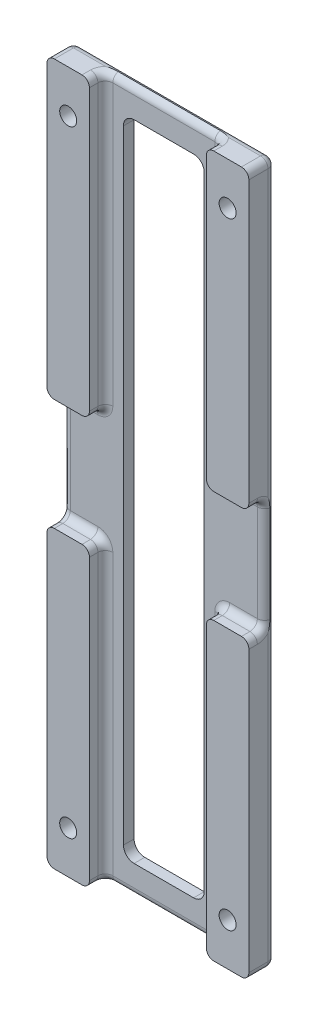
from build123d import *

# Parameters (mm, degrees)
SKETCH1_W           = 55.5
SKETCH1_H           = 8
SKETCH1_R           = 1.6
BOSS_EXTRUDE1_DEPTH = 2
BOSS_EXTRUDE2_START = 2
SKETCH1_3_W         = 55.5
SKETCH1_3_H         = 8
SKETCH1_3_R         = 1.6
BOSS_EXTRUDE2_DEPTH = 3
FILLET1_R           = 1.4
CUT_EXTRUDE1_DEPTH  = 138.393595317


with BuildPart() as part:
    # Sketch1 → Boss-Extrude1 (new body)
    # profile 1 of 5: a face of its own
    with BuildSketch(Plane(origin=(0, 0, 0), x_dir=(0, 1, 0), z_dir=(0, 0, 1))):
        Polygon((76.5, 38), (55.5, 38), (55.5, 30), (0, 30), (0, 8), (55.5, 8), (55.5, 0), (76.5, 0), (76.5, 8), (132, 8), (132, 30), (76.5, 30), align=None)
    # profile 2 of 5: a face of its own
    with BuildSketch(Plane(origin=(0, 0, 0), x_dir=(0, 1, 0), z_dir=(0, 0, 1))):
        with Locations((27.75, 34)):
            Rectangle(SKETCH1_W, SKETCH1_H)
        with Locations(Location((8, 34, 0), (0, 0, 270))):
            Circle(SKETCH1_R, mode=Mode.SUBTRACT)
    # profile 3 of 5: a face of its own
    with BuildSketch(Plane(origin=(0, 0, 0), x_dir=(0, 1, 0), z_dir=(0, 0, 1))):
        with Locations((104.25, 34)):
            Rectangle(SKETCH1_W, SKETCH1_H)
        with Locations(Location((124, 34, 0), (0, 0, 270))):
            Circle(SKETCH1_R, mode=Mode.SUBTRACT)
    # profile 4 of 5: a face of its own
    with BuildSketch(Plane(origin=(0, 0, 0), x_dir=(0, 1, 0), z_dir=(0, 0, 1))):
        with Locations((104.25, 4)):
            Rectangle(SKETCH1_W, SKETCH1_H)
        with Locations(Location((124, 4, 0), (0, 0, 270))):
            Circle(SKETCH1_R, mode=Mode.SUBTRACT)
    # profile 5 of 5: a face of its own
    with BuildSketch(Plane(origin=(0, 0, 0), x_dir=(0, 1, 0), z_dir=(0, 0, 1))):
        with Locations((27.75, 4)):
            Rectangle(SKETCH1_W, SKETCH1_H)
        with Locations(Location((8, 4, 0), (0, 0, 270))):
            Circle(SKETCH1_R, mode=Mode.SUBTRACT)
    extrude(amount=BOSS_EXTRUDE1_DEPTH)

    # Sketch1<3> → Boss-Extrude2 (add)
    # profile 1 of 4: a face of its own
    with BuildSketch(Plane(origin=(0, 0, 0), x_dir=(0, 1, 0), z_dir=(0, 0, 1)).offset(BOSS_EXTRUDE2_START)):
        with Locations((27.75, 34)):
            Rectangle(SKETCH1_3_W, SKETCH1_3_H)
        with Locations(Location((8, 34, 0), (0, 0, 270))):
            Circle(SKETCH1_3_R, mode=Mode.SUBTRACT)
    # profile 2 of 4: a face of its own
    with BuildSketch(Plane(origin=(0, 0, 0), x_dir=(0, 1, 0), z_dir=(0, 0, 1)).offset(BOSS_EXTRUDE2_START)):
        with Locations((104.25, 34)):
            Rectangle(SKETCH1_3_W, SKETCH1_3_H)
        with Locations(Location((124, 34, 0), (0, 0, 270))):
            Circle(SKETCH1_3_R, mode=Mode.SUBTRACT)
    # profile 3 of 4: a face of its own
    with BuildSketch(Plane(origin=(0, 0, 0), x_dir=(0, 1, 0), z_dir=(0, 0, 1)).offset(BOSS_EXTRUDE2_START)):
        with Locations((104.25, 4)):
            Rectangle(SKETCH1_3_W, SKETCH1_3_H)
        with Locations(Location((124, 4, 0), (0, 0, 270))):
            Circle(SKETCH1_3_R, mode=Mode.SUBTRACT)
    # profile 4 of 4: a face of its own
    with BuildSketch(Plane(origin=(0, 0, 0), x_dir=(0, 1, 0), z_dir=(0, 0, 1)).offset(BOSS_EXTRUDE2_START)):
        with Locations((27.75, 4)):
            Rectangle(SKETCH1_3_W, SKETCH1_3_H)
        with Locations(Location((8, 4, 0), (0, 0, 270))):
            Circle(SKETCH1_3_R, mode=Mode.SUBTRACT)
    extrude(amount=BOSS_EXTRUDE2_DEPTH)

    # Fillet1
    # the kernel refuses this fillet: 1.4 mm, written as the material it takes off along each edge
    with BuildSketch(Plane(origin=(-1.4, 130.6, 1.4), x_dir=(1, 0, 0), z_dir=(0, 1, 0))) as fillet1_piece_1_section:
        Polygon((0, 0), (FILLET1_R, 0), (FILLET1_R, FILLET1_R), (0, FILLET1_R), align=None)
    fillet1_piece_1 = extrude(amount=FILLET1_R, mode=Mode.PRIVATE)
    fillet1_piece_1 = fillet1_piece_1 - Plane(origin=(-1.4, 130.6, 1.4), x_dir=(-0.7071067811865475, 0, 0.7071067811865475), z_dir=(0, 1, 0)) * Sphere(FILLET1_R, mode=Mode.PRIVATE)
    with BuildSketch(Plane(origin=(-36.6, 130.6, 1.4), x_dir=(-1, 0, 0), z_dir=(0, 1, 0))) as fillet1_piece_2_section:
        Polygon((0, 0), (FILLET1_R, 0), (FILLET1_R, -FILLET1_R), (0, -FILLET1_R), align=None)
    fillet1_piece_2 = extrude(amount=FILLET1_R, mode=Mode.PRIVATE)
    fillet1_piece_2 = fillet1_piece_2 - Plane(origin=(-36.6, 130.6, 1.4), x_dir=(0.7071067811865475, 0, 0.7071067811865475), z_dir=(0, 1, 0)) * Sphere(FILLET1_R, mode=Mode.PRIVATE)
    with BuildSketch(Plane(origin=(-1.4, 1.4, 1.4), x_dir=(1, 0, 0), z_dir=(0, -1, 0))) as fillet1_piece_3_section:
        Polygon((0, 0), (FILLET1_R, 0), (FILLET1_R, -FILLET1_R), (0, -FILLET1_R), align=None)
    fillet1_piece_3 = extrude(amount=FILLET1_R, mode=Mode.PRIVATE)
    fillet1_piece_3 = fillet1_piece_3 - Plane(origin=(-1.4, 1.4, 1.4), x_dir=(-0.7071067811865475, 0, 0.7071067811865475), z_dir=(0, -1, 0)) * Sphere(FILLET1_R, mode=Mode.PRIVATE)
    with BuildSketch(Plane(origin=(-36.6, 1.4, 1.4), x_dir=(-1, 0, 0), z_dir=(0, -1, 0))) as fillet1_piece_4_section:
        Polygon((0, 0), (FILLET1_R, 0), (FILLET1_R, FILLET1_R), (0, FILLET1_R), align=None)
    fillet1_piece_4 = extrude(amount=FILLET1_R, mode=Mode.PRIVATE)
    fillet1_piece_4 = fillet1_piece_4 - Plane(origin=(-36.6, 1.4, 1.4), x_dir=(0.7071067811865475, 0, 0.7071067811865475), z_dir=(0, -1, 0)) * Sphere(FILLET1_R, mode=Mode.PRIVATE)
    with BuildSketch(Plane(origin=(-1.4, 132, 0), x_dir=(0, -1, 0), z_dir=(-1, 0, 0))) as fillet1_piece_5:
        with BuildLine():
            CenterArc((FILLET1_R, FILLET1_R), FILLET1_R, 180, 90)
            Line((0, FILLET1_R), (0, 0))
            Line((0, 0), (FILLET1_R, 0))
        make_face()
    fillet1_piece_5_solid = extrude(amount=35.2, mode=Mode.PRIVATE)
    with BuildSketch(Plane(origin=(0, 1.4, 0), x_dir=(-1, 0, 0), z_dir=(0, 1, 0)), Plane(origin=(-38, 130.6, 0), x_dir=(1, 0, 0), z_dir=(0, -1, 0))) as fillet1_piece_6:
        with BuildLine():
            CenterArc((FILLET1_R, FILLET1_R), FILLET1_R, 180, 90)
            Line((0, FILLET1_R), (0, 0))
            Line((0, 0), (FILLET1_R, 0))
        make_face()
    fillet1_piece_6_solid = extrude(amount=129.2, mode=Mode.PRIVATE)
    with BuildSketch(Plane(origin=(-36.6, 0, 0), x_dir=(0, 0, 1), z_dir=(1, 0, 0))) as fillet1_piece_7:
        with BuildLine():
            CenterArc((FILLET1_R, -FILLET1_R), FILLET1_R, 90, 90)
            Line((0, -FILLET1_R), (0, 0))
            Line((0, 0), (FILLET1_R, 0))
        make_face()
    fillet1_piece_7_solid = extrude(amount=35.2, mode=Mode.PRIVATE)
    with BuildSketch(Plane(origin=(-38, 132, 8.5), x_dir=(1, 0, 0), z_dir=(0, 0, -1)), Plane(origin=(0, 132, 8.5), x_dir=(0, -1, 0), z_dir=(0, 0, -1)), Plane(origin=(0, 0, 8.5), x_dir=(-1, 0, 0), z_dir=(0, 0, -1)), Plane(origin=(-38, 0, 1.4), x_dir=(1, 0, 0), z_dir=(0, 0, 1))) as fillet1_piece_8:
        with BuildLine():
            CenterArc((FILLET1_R, FILLET1_R), FILLET1_R, 180, 90)
            Line((0, FILLET1_R), (0, 0))
            Line((0, 0), (FILLET1_R, 0))
        make_face()
    fillet1_piece_8_solid = extrude(amount=7.1, mode=Mode.PRIVATE)
    with BuildSketch(Plane(origin=(-8, 55.5, 2), x_dir=(0, -1, 0), z_dir=(0, 0, 1)), Plane(origin=(-8, 76.5, 2), x_dir=(1, 0, 0), z_dir=(0, 0, 1)), Plane(origin=(-30, 76.5, 2), x_dir=(0, 1, 0), z_dir=(0, 0, 1)), Plane(origin=(-30, 55.5, 2), x_dir=(-1, 0, 0), z_dir=(0, 0, 1))) as fillet1_piece_9:
        with BuildLine():
            CenterArc((FILLET1_R, FILLET1_R), FILLET1_R, 180, 90)
            Line((0, FILLET1_R), (0, 0))
            Line((0, 0), (FILLET1_R, 0))
        make_face()
    fillet1_piece_9_solid = extrude(amount=6.5, mode=Mode.PRIVATE)
    add([fillet1_piece_1, fillet1_piece_2, fillet1_piece_3, fillet1_piece_4, fillet1_piece_5_solid, fillet1_piece_6_solid, fillet1_piece_7_solid, fillet1_piece_8_solid, fillet1_piece_9_solid], mode=Mode.SUBTRACT)
    # the kernel refuses this fillet: 1.4 mm, written as the material it adds along each edge
    with BuildSketch(Plane(origin=(0, 55.5, 2), x_dir=(0, 1, 0), z_dir=(-1, 0, 0)), Plane(origin=(-6.6, 76.5, 2), x_dir=(0, -1, 0), z_dir=(1, 0, 0)), Plane(origin=(-38, 76.5, 2), x_dir=(0, -1, 0), z_dir=(1, 0, 0)), Plane(origin=(-31.4, 55.5, 2), x_dir=(0, 1, 0), z_dir=(-1, 0, 0))) as fillet1_2_piece_1:
        with BuildLine():
            CenterArc((FILLET1_R, -FILLET1_R), FILLET1_R, 90, 90)
            Line((0, -FILLET1_R), (0, 0))
            Line((0, 0), (FILLET1_R, 0))
        make_face()
    fillet1_2_piece_1_solid = extrude(amount=6.6, mode=Mode.PRIVATE)
    with BuildSketch(Plane(origin=(-8, 54.1, 2), x_dir=(-1, 0, 0), z_dir=(0, -1, 0)), Plane(origin=(-8, 132, 2), x_dir=(-1, 0, 0), z_dir=(0, -1, 0)), Plane(origin=(-30, 77.9, 2), x_dir=(1, 0, 0), z_dir=(0, 1, 0)), Plane(origin=(-30, 0, 2), x_dir=(1, 0, 0), z_dir=(0, 1, 0))) as fillet1_2_piece_2:
        with BuildLine():
            CenterArc((FILLET1_R, -FILLET1_R), FILLET1_R, 90, 90)
            Line((0, -FILLET1_R), (0, 0))
            Line((0, 0), (FILLET1_R, 0))
        make_face()
    fillet1_2_piece_2_solid = extrude(amount=54.1, mode=Mode.PRIVATE)
    with BuildSketch(Plane(origin=(-31.4, 54.1, 2), x_dir=(0, 1, 0), z_dir=(-1, 0, 0))) as fillet1_2_piece_3:
        with BuildLine():
            CenterArc((1.4 + FILLET1_R, -FILLET1_R), FILLET1_R, 90, 90)
            Line((1.4, -FILLET1_R), (1.4, 0))
            Line((1.4, 0), (1.4 + FILLET1_R, 0))
        make_face()
    fillet1_2_piece_3_solid = revolve(axis=Axis((-31.4, 54.1, 2), (0, 0, -1)), revolution_arc=90, mode=Mode.PRIVATE)
    with BuildSketch(Plane(origin=(-31.4, 77.9, 2), x_dir=(1, 0, 0), z_dir=(0, 1, 0))) as fillet1_2_piece_4:
        with BuildLine():
            CenterArc((1.4 + FILLET1_R, -FILLET1_R), FILLET1_R, 90, 90)
            Line((1.4, -FILLET1_R), (1.4, 0))
            Line((1.4, 0), (1.4 + FILLET1_R, 0))
        make_face()
    fillet1_2_piece_4_solid = revolve(axis=Axis((-31.4, 77.9, 2), (0, 0, -1)), revolution_arc=90, mode=Mode.PRIVATE)
    with BuildSketch(Plane(origin=(-6.6, 77.9, 2), x_dir=(0, -1, 0), z_dir=(1, 0, 0))) as fillet1_2_piece_5:
        with BuildLine():
            CenterArc((1.4 + FILLET1_R, -FILLET1_R), FILLET1_R, 90, 90)
            Line((1.4, -FILLET1_R), (1.4, 0))
            Line((1.4, 0), (1.4 + FILLET1_R, 0))
        make_face()
    fillet1_2_piece_5_solid = revolve(axis=Axis((-6.6, 77.9, 2), (0, 0, -1)), revolution_arc=90, mode=Mode.PRIVATE)
    with BuildSketch(Plane(origin=(-6.6, 54.1, 2), x_dir=(-1, 0, 0), z_dir=(0, -1, 0))) as fillet1_2_piece_6:
        with BuildLine():
            CenterArc((1.4 + FILLET1_R, -FILLET1_R), FILLET1_R, 90, 90)
            Line((1.4, -FILLET1_R), (1.4, 0))
            Line((1.4, 0), (1.4 + FILLET1_R, 0))
        make_face()
    fillet1_2_piece_6_solid = revolve(axis=Axis((-6.6, 54.1, 2), (0, 0, -1)), revolution_arc=90, mode=Mode.PRIVATE)
    add([fillet1_2_piece_1_solid, fillet1_2_piece_2_solid, fillet1_2_piece_3_solid, fillet1_2_piece_4_solid, fillet1_2_piece_5_solid, fillet1_2_piece_6_solid])
    # the kernel refuses this fillet: 1.4 mm, written as the material it takes off along each edge
    with BuildSketch(Plane(origin=(-38, 75.1, 2), x_dir=(1, 0, 0), z_dir=(0, -1, 0)), Plane(origin=(0, 56.9, 2), x_dir=(-1, 0, 0), z_dir=(0, 1, 0))) as fillet1_3_piece_1:
        with BuildLine():
            CenterArc((FILLET1_R, -FILLET1_R), FILLET1_R, 90, 90)
            Line((0, -FILLET1_R), (0, 0))
            Line((0, 0), (FILLET1_R, 0))
        make_face()
    fillet1_3_piece_1_solid = extrude(amount=18.2, mode=Mode.PRIVATE)
    with BuildSketch(Plane(origin=(-28.6, 0, 2), x_dir=(0, 1, 0), z_dir=(1, 0, 0)), Plane(origin=(-9.4, 132, 2), x_dir=(0, -1, 0), z_dir=(-1, 0, 0))) as fillet1_3_piece_2:
        with BuildLine():
            CenterArc((FILLET1_R, -FILLET1_R), FILLET1_R, 90, 90)
            Line((0, -FILLET1_R), (0, 0))
            Line((0, 0), (FILLET1_R, 0))
        make_face()
    fillet1_3_piece_2_solid = extrude(amount=19.2, mode=Mode.PRIVATE)
    with BuildSketch(Plane(origin=(-8, 0, 3.4), x_dir=(1, 0, 0), z_dir=(0, 0, 1)), Plane(origin=(0, 76.5, 3.4), x_dir=(0, 1, 0), z_dir=(0, 0, 1)), Plane(origin=(-30, 132, 3.4), x_dir=(-1, 0, 0), z_dir=(0, 0, 1)), Plane(origin=(-38, 55.5, 3.4), x_dir=(0, -1, 0), z_dir=(0, 0, 1))) as fillet1_3_piece_3:
        with BuildLine():
            CenterArc((FILLET1_R, FILLET1_R), FILLET1_R, 180, 90)
            Line((0, FILLET1_R), (0, 0))
            Line((0, 0), (FILLET1_R, 0))
        make_face()
    fillet1_3_piece_3_solid = extrude(amount=5.1, mode=Mode.PRIVATE)
    with BuildSketch(Plane(origin=(0, 55.5, 3.4), x_dir=(0, -1, 0), z_dir=(0, 0, 1)), Plane(origin=(-8, 132, 3.4), x_dir=(1, 0, 0), z_dir=(0, 0, 1)), Plane(origin=(-38, 76.5, 3.4), x_dir=(0, 1, 0), z_dir=(0, 0, 1)), Plane(origin=(-30, 0, 3.4), x_dir=(-1, 0, 0), z_dir=(0, 0, 1))) as fillet1_3_piece_4:
        with BuildLine():
            CenterArc((FILLET1_R, -FILLET1_R), FILLET1_R, 90, 90)
            Line((0, -FILLET1_R), (0, 0))
            Line((0, 0), (FILLET1_R, 0))
        make_face()
    fillet1_3_piece_4_solid = extrude(amount=5.1, mode=Mode.PRIVATE)
    with BuildSketch(Plane(origin=(-28.6, 0, 3.4), x_dir=(0, 0, -1), z_dir=(1, 0, 0))) as fillet1_3_piece_5:
        with BuildLine():
            CenterArc((1.4 + FILLET1_R, FILLET1_R), FILLET1_R, 180, 90)
            Line((1.4 + FILLET1_R, 0), (1.4, 0))
            Line((1.4, 0), (1.4, FILLET1_R))
        make_face()
    fillet1_3_piece_5_solid = revolve(axis=Axis((-28.6, 0, 3.4), (0, 1, 0)), revolution_arc=90, mode=Mode.PRIVATE)
    with BuildSketch(Plane(origin=(-38, 56.9, 3.4), x_dir=(0, 0, -1), z_dir=(0, 1, 0))) as fillet1_3_piece_6:
        with BuildLine():
            CenterArc((1.4 + FILLET1_R, -FILLET1_R), FILLET1_R, 90, 90)
            Line((1.4 + FILLET1_R, 0), (1.4, 0))
            Line((1.4, 0), (1.4, -FILLET1_R))
        make_face()
    fillet1_3_piece_6_solid = revolve(axis=Axis((-38, 56.9, 3.4), (-1, 0, 0)), revolution_arc=90, mode=Mode.PRIVATE)
    with BuildSketch(Plane(origin=(-38, 75.1, 3.4), x_dir=(0, 0, -1), z_dir=(0, -1, 0))) as fillet1_3_piece_7:
        with BuildLine():
            CenterArc((1.4 + FILLET1_R, FILLET1_R), FILLET1_R, 180, 90)
            Line((1.4, FILLET1_R), (1.4, 0))
            Line((1.4, 0), (1.4 + FILLET1_R, 0))
        make_face()
    fillet1_3_piece_7_solid = revolve(axis=Axis((-38, 75.1, 3.4), (1, 0, 0)), revolution_arc=90, mode=Mode.PRIVATE)
    with BuildSketch(Plane(origin=(-28.6, 132, 3.4), x_dir=(0, 0, -1), z_dir=(1, 0, 0))) as fillet1_3_piece_8:
        with BuildLine():
            CenterArc((1.4 + FILLET1_R, -FILLET1_R), FILLET1_R, 90, 90)
            Line((1.4 + FILLET1_R, 0), (1.4, 0))
            Line((1.4, 0), (1.4, -FILLET1_R))
        make_face()
    fillet1_3_piece_8_solid = revolve(axis=Axis((-28.6, 132, 3.4), (0, 1, 0)), revolution_arc=90, mode=Mode.PRIVATE)
    with BuildSketch(Plane(origin=(-9.4, 132, 3.4), x_dir=(0, 0, -1), z_dir=(-1, 0, 0))) as fillet1_3_piece_9:
        with BuildLine():
            CenterArc((1.4 + FILLET1_R, FILLET1_R), FILLET1_R, 180, 90)
            Line((1.4, FILLET1_R), (1.4, 0))
            Line((1.4, 0), (1.4 + FILLET1_R, 0))
        make_face()
    fillet1_3_piece_9_solid = revolve(axis=Axis((-9.4, 132, 3.4), (0, -1, 0)), revolution_arc=90, mode=Mode.PRIVATE)
    with BuildSketch(Plane(origin=(0, 75.1, 3.4), x_dir=(0, 0, -1), z_dir=(0, -1, 0))) as fillet1_3_piece_10:
        with BuildLine():
            CenterArc((1.4 + FILLET1_R, -FILLET1_R), FILLET1_R, 90, 90)
            Line((1.4 + FILLET1_R, 0), (1.4, 0))
            Line((1.4, 0), (1.4, -FILLET1_R))
        make_face()
    fillet1_3_piece_10_solid = revolve(axis=Axis((0, 75.1, 3.4), (1, 0, 0)), revolution_arc=90, mode=Mode.PRIVATE)
    with BuildSketch(Plane(origin=(0, 56.9, 3.4), x_dir=(0, 0, -1), z_dir=(0, 1, 0))) as fillet1_3_piece_11:
        with BuildLine():
            CenterArc((1.4 + FILLET1_R, FILLET1_R), FILLET1_R, 180, 90)
            Line((1.4, FILLET1_R), (1.4, 0))
            Line((1.4, 0), (1.4 + FILLET1_R, 0))
        make_face()
    fillet1_3_piece_11_solid = revolve(axis=Axis((0, 56.9, 3.4), (-1, 0, 0)), revolution_arc=90, mode=Mode.PRIVATE)
    with BuildSketch(Plane(origin=(-9.4, 0, 3.4), x_dir=(0, 0, -1), z_dir=(-1, 0, 0))) as fillet1_3_piece_12:
        with BuildLine():
            CenterArc((1.4 + FILLET1_R, -FILLET1_R), FILLET1_R, 90, 90)
            Line((1.4 + FILLET1_R, 0), (1.4, 0))
            Line((1.4, 0), (1.4, -FILLET1_R))
        make_face()
    fillet1_3_piece_12_solid = revolve(axis=Axis((-9.4, 0, 3.4), (0, -1, 0)), revolution_arc=90, mode=Mode.PRIVATE)
    add([fillet1_3_piece_1_solid, fillet1_3_piece_2_solid, fillet1_3_piece_3_solid, fillet1_3_piece_4_solid, fillet1_3_piece_5_solid, fillet1_3_piece_6_solid, fillet1_3_piece_7_solid, fillet1_3_piece_8_solid, fillet1_3_piece_9_solid, fillet1_3_piece_10_solid, fillet1_3_piece_11_solid, fillet1_3_piece_12_solid], mode=Mode.SUBTRACT)

    # Sketch2 → Cut-Extrude1 (cut, through all)
    with BuildSketch(Plane.XY.offset(2)):
        with BuildLine():
            Line((-24.6, 126.6), (-13.4, 126.6))
            ThreePointArc((-13.4, 126.6), (-11.985786438, 126.014213562), (-11.4, 124.6))
            Line((-11.4, 124.6), (-11.4, 7.4))
            ThreePointArc((-11.4, 7.4), (-11.985786438, 5.985786438), (-13.4, 5.4))
            Line((-13.4, 5.4), (-24.6, 5.4))
            ThreePointArc((-24.6, 5.4), (-26.014213562, 5.985786438), (-26.6, 7.4))
            Line((-26.6, 7.4), (-26.6, 124.6))
            ThreePointArc((-26.6, 124.6), (-26.014213562, 126.014213562), (-24.6, 126.6))
        make_face()
    extrude(amount=-CUT_EXTRUDE1_DEPTH, mode=Mode.SUBTRACT)


solid = part.part
